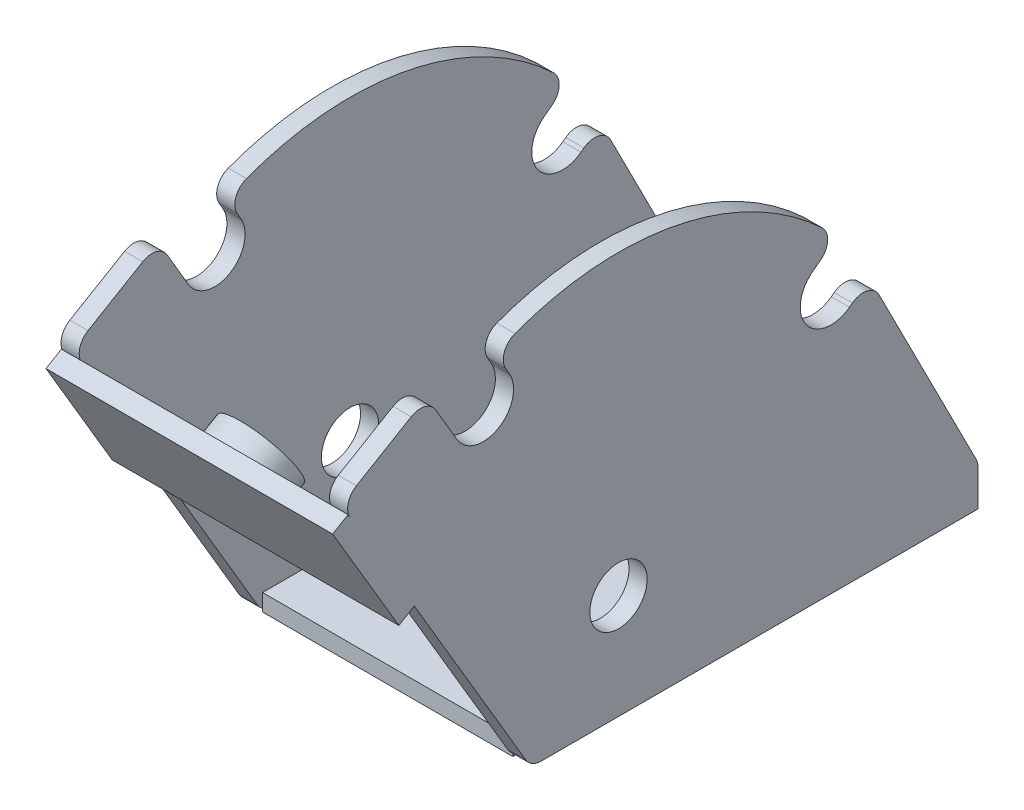
from build123d import *

# Parameters (mm, degrees)
SKETCH1_W           = 35.56
SKETCH1_H           = 63.5
SKETCH1_R           = 3.0734
BOSS_EXTRUDE1_DEPTH = 2.4003
SKETCH2_R           = 4.07035
BOSS_EXTRUDE2_DEPTH = 2.5781
SKETCH3_W           = 40.7162
SKETCH3_H           = 18.5166
BOSS_EXTRUDE3_DEPTH = 2.54
SKETCH4_R           = 5.5626
BOSS_EXTRUDE4_DEPTH = 3.7846


with BuildPart() as part:
    # Sketch1 → Boss-Extrude1 (new body)
    with BuildSketch(Plane(origin=(0, 0, 0), x_dir=(1, 0, 0), z_dir=(0, 1, 0))):
        Rectangle(SKETCH1_W, SKETCH1_H)
        with Locations((-11.0109, 18.288)):
            Circle(SKETCH1_R, mode=Mode.SUBTRACT)
        with Locations((-11.0109, -22.225)):
            Circle(SKETCH1_R, mode=Mode.SUBTRACT)
        with Locations((11.0109, -22.225)):
            Circle(SKETCH1_R, mode=Mode.SUBTRACT)
        with Locations((11.0109, 18.288)):
            Circle(SKETCH1_R, mode=Mode.SUBTRACT)
    extrude(amount=BOSS_EXTRUDE1_DEPTH)

    # Sketch2 → Boss-Extrude2 (add)
    with BuildSketch(Plane(origin=(17.78, 0, 0), x_dir=(0, 0, -1), z_dir=(1, 0, 0))):
        with BuildLine():
            Line((31.75, 0), (31.75, 5.119118053))
            ThreePointArc((31.75, 5.119118053), (31.680088236, 5.710949198), (31.474201493, 6.270200848))
            Line((31.474201493, 6.270200848), (17.693567666, 33.376966591))
            ThreePointArc((17.693567666, 33.376966591), (16.006303844, 34.699493087), (13.908046107, 34.259890987))
            Line((13.908046107, 34.259890987), (13.489778208, 33.947050723))
            ThreePointArc((13.489778208, 33.947050723), (7.374615324, 34.828872577), (8.256437178, 40.944035461))
            Line((8.256437178, 40.944035461), (9.378285973, 41.783113656))
            ThreePointArc((9.378285973, 41.783113656), (10.39301658, 43.675533493), (9.59524257, 45.66914521))
            ThreePointArc((9.59524257, 45.66914521), (-10.963994808, 56.277959645), (-34.028081087, 54.467680828))
            ThreePointArc((-34.028081087, 54.467680828), (-35.535691357, 52.940715566), (-35.336051172, 50.80421014))
            Line((-35.336051172, 50.80421014), (-34.816573654, 49.916114029))
            ThreePointArc((-34.816573654, 49.916114029), (-36.36360729, 44.008751256), (-42.270970063, 45.555784893))
            Line((-42.270970063, 45.555784893), (-45.277675805, 50.696033664))
            ThreePointArc((-45.277675805, 50.696033664), (-46.831353511, 51.871946179), (-48.760952094, 51.601143727))
            Line((-48.760952094, 51.601143727), (-56.540301411, 47.010806757))
            ThreePointArc((-56.540301411, 47.010806757), (-57.70907124, 45.457347112), (-57.437054463, 43.532440191))
            Line((-57.437054463, 43.532440191), (-32.487107654, 1.249193243))
            ThreePointArc((-32.487107654, 1.249193243), (-31.559101504, 0.334297259), (-30.299547846, 0))
            Line((-30.299547846, 0), (31.75, 0))
        make_face()
        with Locations((-19.316644044, 14.86535)):
            Circle(SKETCH2_R, mode=Mode.SUBTRACT)
    boss_extrude2 = extrude(amount=BOSS_EXTRUDE2_DEPTH)

    # Mirror1: Boss-Extrude2 across plane
    add(boss_extrude2.mirror(Plane.ZY))

    # Sketch3 → Boss-Extrude3 (add)
    with BuildSketch(Plane(origin=(0, -13.896244991, 23.550285021), x_dir=(1, 0, 0), z_dir=(0, -0.5081916365877369, 0.8612440191387559))):
        with Locations((0, 58.016828481)):
            Rectangle(SKETCH3_W, SKETCH3_H)
    extrude(amount=BOSS_EXTRUDE3_DEPTH)

    # Sketch4 → Boss-Extrude4 (add)
    with BuildSketch(Plane(origin=(0, -13.896244991, 23.550285021), x_dir=(-1, 0, 0), z_dir=(0, 0.5081916365877371, -0.8612440191387557))):
        with Locations((0, 58.016828481)):
            Circle(SKETCH4_R)
    extrude(amount=BOSS_EXTRUDE4_DEPTH)


solid = part.part
